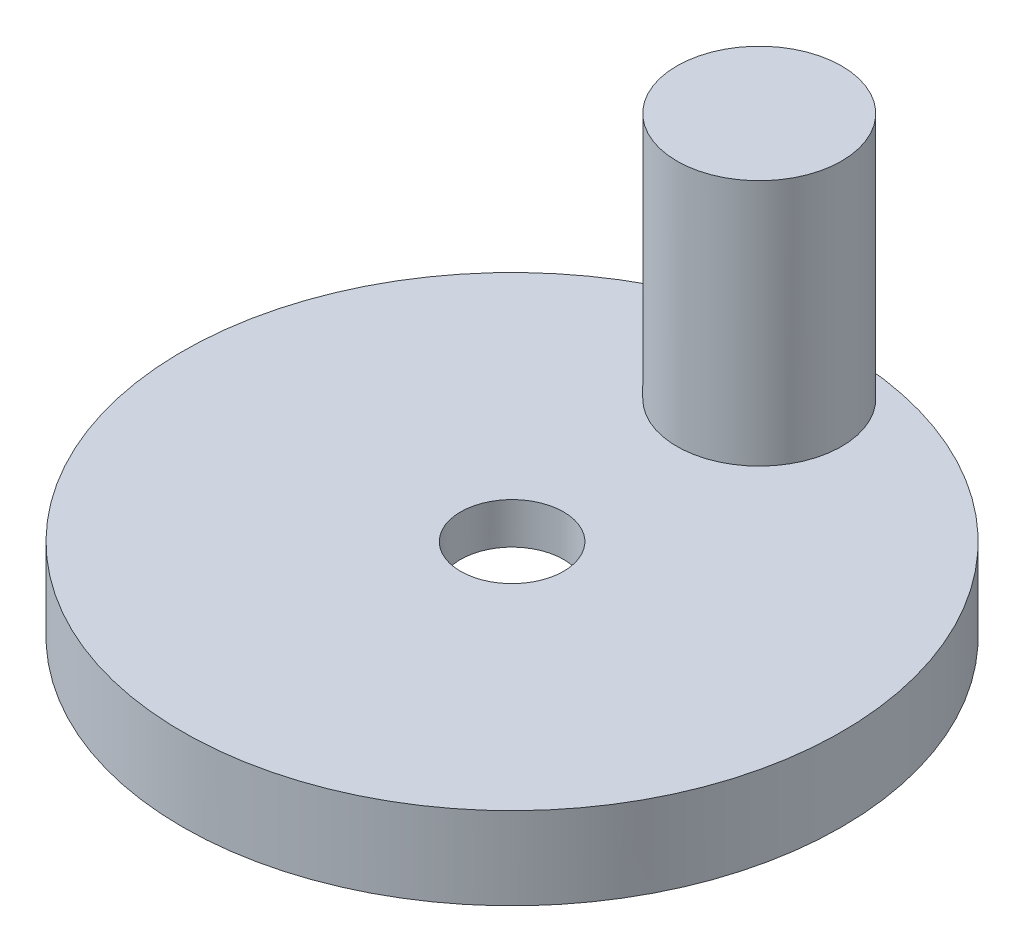
from build123d import *

# Parameters (mm, degrees)
SKETCH_1_R          = 8
SKETCH_1_R_2        = 1.25
EXTRUDE_1_DEPTH     = 2
SKETCH_2_R          = 4
CUT_EXTRUDE_1_DEPTH = 1
SKETCH_3_R          = 2
EXTRUDE_2_DEPTH     = 6


with BuildPart() as part:
    # 草图1 → 凸台-拉伸1 (new body)
    with BuildSketch(Plane(origin=(0, 0, 0), x_dir=(1, 0, 0), z_dir=(0, 1, 0))):
        Circle(SKETCH_1_R)
        Circle(SKETCH_1_R_2, mode=Mode.SUBTRACT)
    extrude(amount=EXTRUDE_1_DEPTH)

    # 草图2 → 切除-拉伸1 (cut)
    with BuildSketch(Plane.XZ):
        Circle(SKETCH_2_R)
    extrude(amount=-CUT_EXTRUDE_1_DEPTH, mode=Mode.SUBTRACT)

    # 草图3 → 凸台-拉伸2 (add)
    with BuildSketch(Plane(origin=(0, 2, 0), x_dir=(1, 0, 0), z_dir=(0, 1, 0))):
        with Locations((0, 6)):
            Circle(SKETCH_3_R)
    extrude(amount=EXTRUDE_2_DEPTH)


solid = part.part
